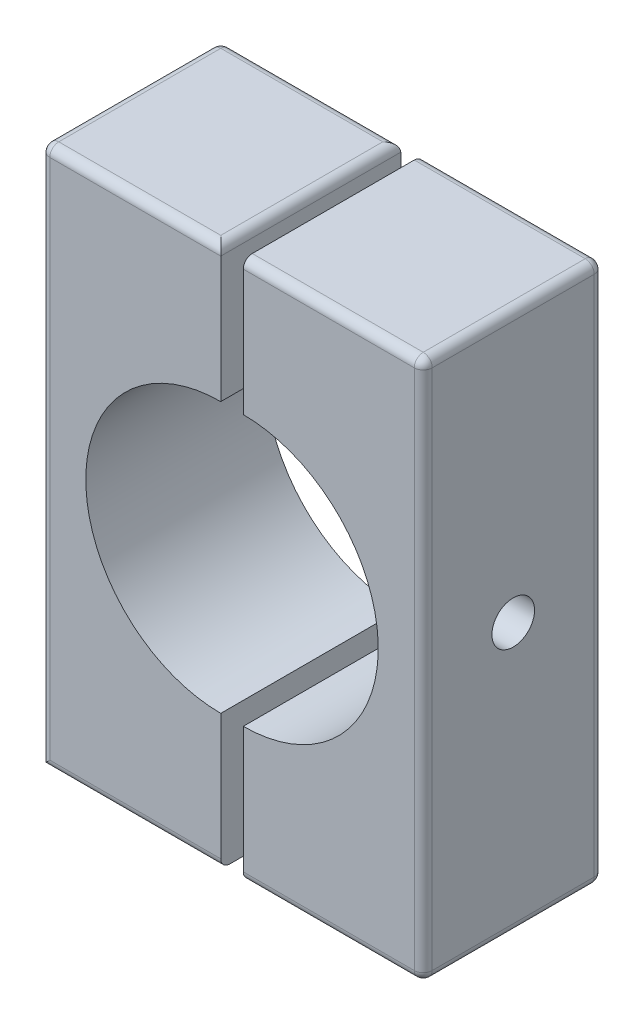
from build123d import *

# Parameters (mm, degrees)
BOSS_EXTRUDE1_DEPTH   = 40
BOSS_EXTRUDE1_2_DEPTH = 40
FILLET1_R             = 2
FILLET2_R             = 2
FILLET3_R             = 2
SKETCH2_R             = 3.5
CUT_EXTRUDE2_DEPTH    = 8
SKETCH3_R             = 4.739315761
CUT_EXTRUDE3_DEPTH    = 8


with BuildPart() as part:
    # Sketch1 → Boss-Extrude1 (new body)
    with BuildSketch(Plane.XY):
        with BuildLine():
            Line((-9.961849725, -64.993102173), (-9.961849725, -94.993102173))
            Line((-9.961849725, -94.993102173), (-49.961849725, -94.993102173))
            Line((-49.961849725, -94.993102173), (-49.961849725, 25.006897827))
            Line((-49.961849725, 25.006897827), (-9.961849725, 25.006897827))
            Line((-9.961849725, 25.006897827), (-9.961849725, -4.993102173))
            ThreePointArc((-9.961849725, -4.993102173), (-39.961849725, -34.993102173), (-9.961849725, -64.993102173))
        make_face()
    extrude(amount=BOSS_EXTRUDE1_DEPTH)

    # Fillet2
    fillet2_edges = [part.edges().sort_by_distance(p)[0] for p in [
        (-49.961849725, 25.006897827, 20),
        (-9.961849725, 25.006897827, 20),
        (-29.961849725, 25.006897827, 40),
        (-49.961849725, -34.993102173, 40),
        (-29.961849725, 25.006897827, 0),
        (-29.961849725, -94.993102173, 40),
        (-29.961849725, -94.993102173, 0),
        (-49.961849725, -34.993102173, 0),
    ]]
    fillet(fillet2_edges, radius=FILLET2_R)

    # Sketch2 → Cut-Extrude2 (cut)
    with BuildSketch(Plane.ZY.offset(49.961849725)):
        with Locations(Location((20, -34.993102173, 0), (0, 0, 270))):
            Circle(SKETCH2_R)
    extrude(amount=-CUT_EXTRUDE2_DEPTH, mode=Mode.SUBTRACT)


with BuildPart() as body_2:
    # Sketch1 → Boss-Extrude1 2 (new body)
    with BuildSketch(Plane.XY):
        with BuildLine():
            Line((-4.961849725, 25.006897827), (35.038150275, 25.006897827))
            Line((35.038150275, 25.006897827), (35.038150275, -94.993102173))
            Line((35.038150275, -94.993102173), (-4.961849725, -94.993102173))
            Line((-4.961849725, -94.993102173), (-4.961849725, -64.993102173))
            ThreePointArc((-4.961849725, -64.993102173), (25.038150275, -34.993102173), (-4.961849725, -4.993102173))
            Line((-4.961849725, -4.993102173), (-4.961849725, 25.006897827))
        make_face()
    extrude(amount=BOSS_EXTRUDE1_2_DEPTH)

    # Fillet1
    fillet1_edges = [body_2.edges().sort_by_distance(p)[0] for p in [
        (35.038150275, 25.006897827, 20),
        (35.038150275, -34.993102173, 40),
        (15.038150275, 25.006897827, 40),
        (15.038150275, 25.006897827, 0),
        (35.038150275, -34.993102173, 0),
        (15.038150275, -94.993102173, 0),
    ]]
    fillet(fillet1_edges, radius=FILLET1_R)

    # Fillet3
    # the kernel refuses this fillet: 2 mm, written as the material it takes off along each edge
    with BuildSketch(Plane(origin=(33.038150275, -92.993102173, 2), x_dir=(1, 0, 0), z_dir=(0, -1, 0))) as fillet3_piece_1_section:
        Polygon((0, 0), (FILLET3_R, 0), (FILLET3_R, -FILLET3_R), (0, -FILLET3_R), align=None)
    fillet3_piece_1 = extrude(amount=FILLET3_R, mode=Mode.PRIVATE)
    fillet3_piece_1 = fillet3_piece_1 - Plane(origin=(33.038150275, -92.993102173, 2), x_dir=(-0.7071067811865475, 0, 0.7071067811865475), z_dir=(0, -1, 0)) * Sphere(FILLET3_R, mode=Mode.PRIVATE)
    add(fillet3_piece_1, mode=Mode.SUBTRACT)
    with BuildSketch(Plane(origin=(33.038150275, -94.993102173, 40), x_dir=(0, 1, 0), z_dir=(-1, 0, 0))) as fillet3_piece_2:
        with BuildLine():
            CenterArc((FILLET3_R, FILLET3_R), FILLET3_R, 180, 90)
            Line((0, FILLET3_R), (0, 0))
            Line((0, 0), (FILLET3_R, 0))
        make_face()
    extrude(amount=43, mode=Mode.SUBTRACT)
    with BuildSketch(Plane(origin=(35.038150275, -94.993102173, 2), x_dir=(-1, 0, 0), z_dir=(0, 0, 1))) as fillet3_piece_3:
        with BuildLine():
            CenterArc((FILLET3_R, -FILLET3_R), FILLET3_R, 90, 90)
            Line((0, -FILLET3_R), (0, 0))
            Line((0, 0), (FILLET3_R, 0))
        make_face()
    extrude(amount=36, mode=Mode.SUBTRACT)
    with BuildSketch(Plane(origin=(33.038150275, -94.993102173, 38), x_dir=(1, 0, 0), z_dir=(0, 0, -1))) as fillet3_piece_4:
        with BuildLine():
            CenterArc((2 - FILLET3_R, -FILLET3_R), FILLET3_R, 0, 90)
            Line((2 - FILLET3_R, 0), (2, 0))
            Line((2, 0), (2, -FILLET3_R))
        make_face()
    revolve(axis=Axis((33.038150275, -94.993102173, 38), (0, -1, 0)), revolution_arc=90, mode=Mode.SUBTRACT)

    # Sketch3 → Cut-Extrude3 (cut)
    with BuildSketch(Plane(origin=(35.038150275, 0, 0), x_dir=(0, 0, -1), z_dir=(1, 0, 0))):
        with Locations(Location((-20, -34.993102173, 0), (0, 0, 90))):
            Circle(SKETCH3_R)
    extrude(amount=-CUT_EXTRUDE3_DEPTH, mode=Mode.SUBTRACT)


solid = Compound([part.part, body_2.part])
